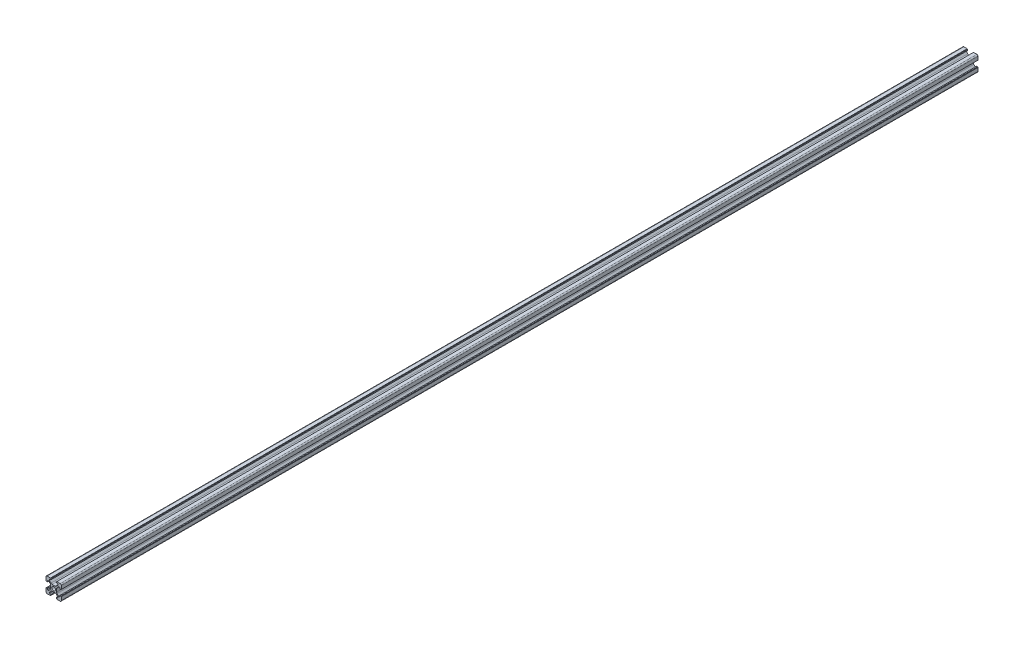
from build123d import *

# Parameters (mm, degrees)
SKETCH1_R           = 2.5
BOSS_EXTRUDE2_DEPTH = 1200


with BuildPart() as part:
    # Sketch1 → Boss-Extrude2 (new body)
    with BuildSketch(Plane.XY):
        with BuildLine():
            Line((10, -8.5), (10, -4.1))
            Line((10, -4.1), (9.5, -4.1))
            Line((9.5, -4.1), (9.5, -3.6))
            Line((9.5, -3.6), (8.2, -3.6))
            Line((8.2, -3.6), (8.2, -5.5))
            Line((8.2, -5.5), (6.560660172, -5.5))
            Line((6.560660172, -5.5), (4.485786438, -3.425126266))
            ThreePointArc((4.485786438, -3.425126266), (4.052240935, -2.776279568), (3.9, -2.010912703))
            Line((3.9, -2.010912703), (3.9, 2.010912703))
            ThreePointArc((3.9, 2.010912703), (4.052240935, 2.776279568), (4.485786438, 3.425126266))
            Line((4.485786438, 3.425126266), (6.560660172, 5.5))
            Line((6.560660172, 5.5), (8.2, 5.5))
            Line((8.2, 5.5), (8.2, 3.6))
            Line((8.2, 3.6), (9.5, 3.6))
            Line((9.5, 3.6), (9.5, 4.1))
            Line((9.5, 4.1), (10, 4.1))
            Line((10, 4.1), (10, 8.5))
            ThreePointArc((10, 8.5), (9.560660172, 9.560660172), (8.5, 10))
            Line((8.5, 10), (4.1, 10))
            Line((4.1, 10), (4.1, 9.5))
            Line((4.1, 9.5), (3.6, 9.5))
            Line((3.6, 9.5), (3.6, 8.2))
            Line((3.6, 8.2), (5.5, 8.2))
            Line((5.5, 8.2), (5.5, 6.560660172))
            Line((5.5, 6.560660172), (3.425126266, 4.485786438))
            ThreePointArc((3.425126266, 4.485786438), (2.776279568, 4.052240935), (2.010912703, 3.9))
            Line((2.010912703, 3.9), (-2.010912703, 3.9))
            ThreePointArc((-2.010912703, 3.9), (-2.776279568, 4.052240935), (-3.425126266, 4.485786438))
            Line((-3.425126266, 4.485786438), (-5.5, 6.560660172))
            Line((-5.5, 6.560660172), (-5.5, 8.2))
            Line((-5.5, 8.2), (-3.6, 8.2))
            Line((-3.6, 8.2), (-3.6, 9.5))
            Line((-3.6, 9.5), (-4.1, 9.5))
            Line((-4.1, 9.5), (-4.1, 10))
            Line((-4.1, 10), (-8.5, 10))
            ThreePointArc((-8.5, 10), (-9.560660172, 9.560660172), (-10, 8.5))
            Line((-10, 8.5), (-10, 4.1))
            Line((-10, 4.1), (-9.5, 4.1))
            Line((-9.5, 4.1), (-9.5, 3.6))
            Line((-9.5, 3.6), (-8.2, 3.6))
            Line((-8.2, 3.6), (-8.2, 5.5))
            Line((-8.2, 5.5), (-6.560660172, 5.5))
            Line((-6.560660172, 5.5), (-4.485786438, 3.425126266))
            ThreePointArc((-4.485786438, 3.425126266), (-4.052240935, 2.776279568), (-3.9, 2.010912703))
            Line((-3.9, 2.010912703), (-3.9, -2.010912703))
            ThreePointArc((-3.9, -2.010912703), (-4.052240935, -2.776279568), (-4.485786438, -3.425126266))
            Line((-4.485786438, -3.425126266), (-6.560660172, -5.5))
            Line((-6.560660172, -5.5), (-8.2, -5.5))
            Line((-8.2, -5.5), (-8.2, -3.6))
            Line((-8.2, -3.6), (-9.5, -3.6))
            Line((-9.5, -3.6), (-9.5, -4.1))
            Line((-9.5, -4.1), (-10, -4.1))
            Line((-10, -4.1), (-10, -8.5))
            ThreePointArc((-10, -8.5), (-9.560660172, -9.560660172), (-8.5, -10))
            Line((-8.5, -10), (-4.1, -10))
            Line((-4.1, -10), (-4.1, -9.5))
            Line((-4.1, -9.5), (-3.6, -9.5))
            Line((-3.6, -9.5), (-3.6, -8.2))
            Line((-3.6, -8.2), (-5.5, -8.2))
            Line((-5.5, -8.2), (-5.5, -6.560660172))
            Line((-5.5, -6.560660172), (-3.425126266, -4.485786438))
            ThreePointArc((-3.425126266, -4.485786438), (-2.776279568, -4.052240935), (-2.010912703, -3.9))
            Line((-2.010912703, -3.9), (2.010912703, -3.9))
            ThreePointArc((2.010912703, -3.9), (2.776279568, -4.052240935), (3.425126266, -4.485786438))
            Line((3.425126266, -4.485786438), (5.5, -6.560660172))
            Line((5.5, -6.560660172), (5.5, -8.2))
            Line((5.5, -8.2), (3.6, -8.2))
            Line((3.6, -8.2), (3.6, -9.5))
            Line((3.6, -9.5), (4.1, -9.5))
            Line((4.1, -9.5), (4.1, -10))
            Line((4.1, -10), (8.5, -10))
            ThreePointArc((8.5, -10), (9.560660172, -9.560660172), (10, -8.5))
        make_face()
        Circle(SKETCH1_R, mode=Mode.SUBTRACT)
    extrude(amount=BOSS_EXTRUDE2_DEPTH)


solid = part.part
